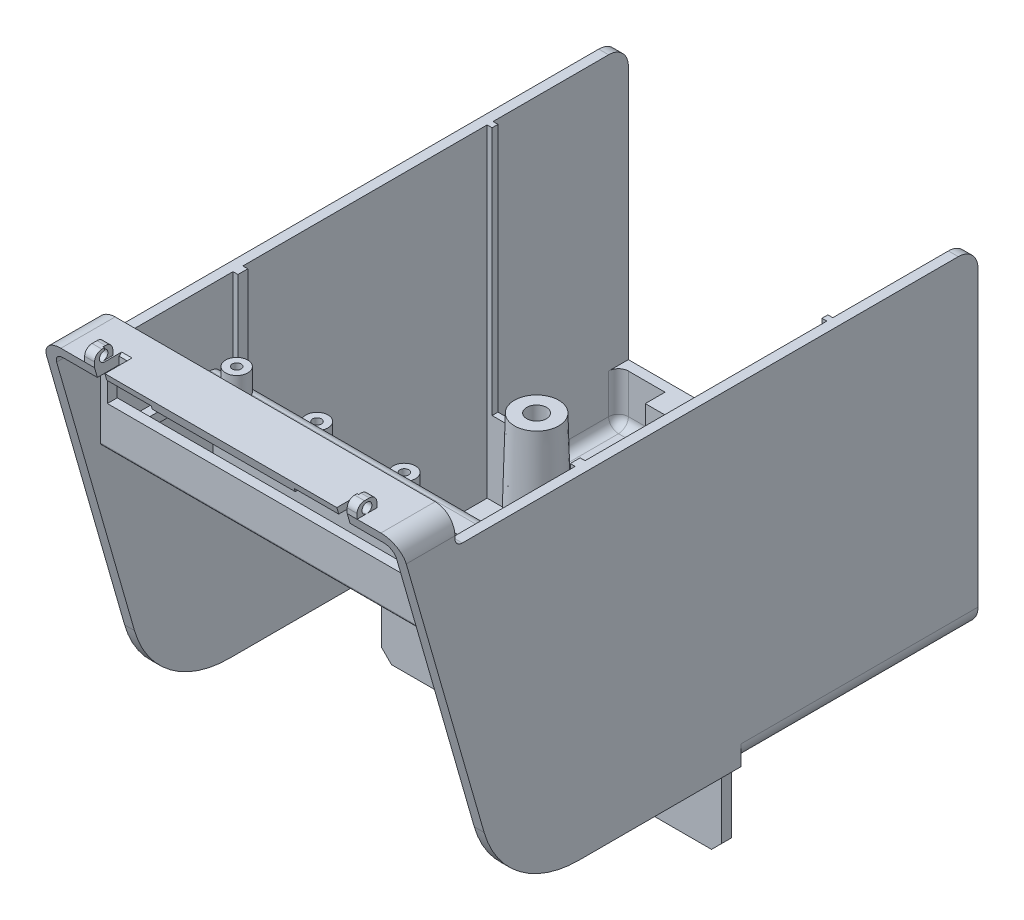
from build123d import *

# Parameters (mm, degrees)
BOSS_EXTRUDE1_DEPTH             = 66
BOSS_EXTRUDE1_DEPTH_BACK        = 7.5
SKETCH1_W                       = 72.85
SKETCH1_H                       = 108.98
CUT_EXTRUDE1_DEPTH              = 113.393427744
CUT_EXTRUDE1_DEPTH_BACK         = 113.393427744
FILLET1_R                       = 0.5
SHELL1_T                        = -2
CUT_EXTRUDE2_REACH              = 84.687
SKETCH3_W                       = 65
SKETCH3_H                       = 10
CUT_EXTRUDE3_REACH              = 79.242
SKETCH4_W                       = 65
SKETCH4_H                       = 10
CUT_EXTRUDE4_REACH              = 89.953
SKETCH5_W                       = 65
SKETCH5_H                       = 10
SKETCH7_R                       = 2.25
BOSS_EXTRUDE2_DEPTH             = 4.5
BOSS_EXTRUDE2_DIRECTION_2_REACH = 85.921
BOSS_EXTRUDE3_DEPTH             = 4.5
BOSS_EXTRUDE3_DEPTH_BACK        = 2
SKETCH8_R                       = 2.25
SKETCH9_R                       = 2.25
BOSS_EXTRUDE4_DEPTH             = 4.5
BOSS_EXTRUDE4_DIRECTION_2_REACH = 88.632
CUT_EXTRUDE5_REACH              = 134.512
SKETCH10_W                      = 66
SKETCH10_H                      = 6.5
SKETCH11_R                      = 5
BOSS_EXTRUDE5_DEPTH             = 19.35
BOSS_EXTRUDE5_DRAFT             = 1.5
BOSS_EXTRUDE5_PROFILE_2_DEPTH   = 19.35
BOSS_EXTRUDE5_PROFILE_2_DRAFT   = 1.5
SKETCH53_R                      = 2
SKETCH53_R_2                    = 2.25
CUT_EXTRUDE30_DEPTH             = 10
BOSS_EXTRUDE6_DEPTH             = 2
SKETCH20_W                      = 68.85
SKETCH20_H                      = 10
BOSS_EXTRUDE7_DEPTH             = 2
CUT_EXTRUDE12_DEPTH             = 118.567353462
CUT_EXTRUDE6_REACH              = 106.346
SKETCH13_W                      = 68.85
SKETCH13_H                      = 2.5
FILLET4_R                       = 3
SKETCH14_W                      = 70.85
SKETCH14_H                      = 118.430630558
CUT_EXTRUDE7_DEPTH              = 1.5
SKETCH17_R                      = 0.9
CUT_EXTRUDE9_DEPTH              = 4
SKETCH18_R                      = 0.9
CUT_EXTRUDE10_DEPTH             = 4
SKETCH19_R                      = 0.9
CUT_EXTRUDE11_DEPTH             = 4
SKETCH22_W                      = 107.98
SKETCH22_H                      = 6
CUT_EXTRUDE13_DEPTH             = 118.567353462
SKETCH23_W                      = 68.85
SKETCH23_H                      = 1
BOSS_EXTRUDE8_DEPTH             = 4
FILLET6_R                       = 2
FILLET7_R                       = 2
FILLET8_R                       = 4
SKETCH28_W                      = 68.85
SKETCH28_H                      = 2
BOSS_EXTRUDE10_DEPTH            = 15.53
CHAMFER2_SIZE                   = 2
SKETCH29_R                      = 1.75
CUT_EXTRUDE16_DEPTH             = 101.855245897
BOSS_EXTRUDE17_REACH            = 118.339
SKETCH56_W                      = 1.2
SKETCH56_H                      = 15
BOSS_EXTRUDE18_REACH            = 118.339
SKETCH57_W                      = 1.2
SKETCH57_H                      = 15
FILLET10_R                      = 2
CUT_EXTRUDE17_DEPTH             = 49.98
SKETCH31_W                      = 2.5
SKETCH31_H                      = 67.5
CUT_EXTRUDE18_DEPTH             = 89.83
BOSS_EXTRUDE11_START            = 0.52
BOSS_EXTRUDE11_DEPTH            = 0.52
SKETCH33_W                      = 68.85
SKETCH33_H                      = 2
BOSS_EXTRUDE12_DEPTH            = 10
FILLET11_R                      = 2
FILLET12_R                      = 4
FILLET13_R                      = 1.5
BOSS_EXTRUDE13_REACH            = 104.947
SKETCH34_W                      = 6
SKETCH34_H                      = 4
SKETCH35_R                      = 1.1
CUT_EXTRUDE19_DEPTH             = 6
FILLET14_R                      = 2
SKETCH37_W                      = 9
SKETCH37_H                      = 2
CUT_EXTRUDE20_DEPTH             = 130.25858047
SKETCH41_W                      = 2
SKETCH41_H                      = 4
BOSS_EXTRUDE15_DEPTH            = 2.5
SKETCH43_R                      = 1
CUT_EXTRUDE22_DEPTH             = 2
FILLET16_R                      = 1.5
FILLET16_OF_MIRROR3_R           = 1.5
SKETCH44_W                      = 2.1
SKETCH44_H                      = 4
CUT_EXTRUDE23_DEPTH             = 2
SKETCH45_W                      = 65
SKETCH45_H                      = 2
CUT_EXTRUDE24_DEPTH             = 1.5
SKETCH46_W                      = 65
SKETCH46_H                      = 2
CUT_EXTRUDE25_DEPTH             = 0.1
SKETCH47_W                      = 65
SKETCH47_H                      = 2
CUT_EXTRUDE26_DEPTH             = 0.1
SKETCH48_W                      = 65
SKETCH48_H                      = 2
BOSS_EXTRUDE16_DEPTH            = 1
SKETCH50_W                      = 2
SKETCH50_H                      = 2.5
CUT_EXTRUDE27_DEPTH             = 0.3
SKETCH51_W                      = 2
SKETCH51_H                      = 2.5
CUT_EXTRUDE28_DEPTH             = 0.3
SKETCH52_W                      = 2.1
SKETCH52_H                      = 2
CUT_EXTRUDE29_DEPTH             = 1
CHAMFER3_SIZE                   = 0.5
SKETCH58_W                      = 1
SKETCH58_H                      = 1.2
BOSS_EXTRUDE19_DEPTH            = 50.5
SKETCH60_W                      = 1
SKETCH60_H                      = 2
BOSS_EXTRUDE21_DEPTH            = 32.87


with BuildPart() as part:
    # Sketch1 → Boss-Extrude1 (new, two sides: drawn at the far end of the back side and taken through both)
    with BuildSketch(Plane(origin=(0, 0, 0), x_dir=(1, 0, 0), z_dir=(0, 1, 0)).offset(-BOSS_EXTRUDE1_DEPTH_BACK)):
        Rectangle(SKETCH1_W, SKETCH1_H)
    extrude(amount=BOSS_EXTRUDE1_DEPTH + BOSS_EXTRUDE1_DEPTH_BACK)

    # Sketch2 → Cut-Extrude1 (cut, two sides: drawn at the far end of the back side and taken through both)
    with BuildSketch(Plane(origin=(36.425, 0, 0), x_dir=(0, 0, -1), z_dir=(1, 0, 0)).offset(-CUT_EXTRUDE1_DEPTH_BACK)):
        Polygon((-54.49, 338.898386454), (-54.49, 66), (-54.49, 42.91), (-31.71, 42.91), (-31.71, 25.13), (-14.01, 25.13), (-14.01, 7.35), (2.51, 7.35), (2.51, -7.5), (2.51, -280.398386454), (-540.989543276, -330.422018615), (-597.989543276, 288.874754292), align=None)
    extrude(amount=CUT_EXTRUDE1_DEPTH + CUT_EXTRUDE1_DEPTH_BACK, mode=Mode.SUBTRACT)

    # Fillet1
    fillet1_edges = [part.edges().sort_by_distance(p)[0] for p in [
        (0, 42.91, 54.49),
        (0, 42.91, 31.71),
        (0, 25.13, 31.71),
        (0, 25.13, 14.01),
        (0, 7.35, 14.01),
        (0, 7.35, -2.51),
    ]]
    fillet(fillet1_edges, radius=FILLET1_R)

    # Shell1
    shell1_openings = [part.faces().sort_by_distance(p)[0] for p in [
        (0, 66, 0),
        (0, 29.25, -54.49),
    ]]
    offset(amount=SHELL1_T, openings=shell1_openings, kind=Kind.INTERSECTION)

    # Sketch3 → Cut-Extrude2 (cut, up to next)
    with BuildSketch(Plane.XZ.offset(-42.91), mode=Mode.PRIVATE) as cut_extrude2_sk1:
        with Locations((0, 42.39)):
            Rectangle(SKETCH3_W, SKETCH3_H)
    cut_extrude2_tool1 = extrude(cut_extrude2_sk1.sketch, amount=-CUT_EXTRUDE2_REACH, mode=Mode.PRIVATE) & part.part
    add(cut_extrude2_tool1.solids().sort_by_distance((0, 42.91, 42.39))[0], mode=Mode.SUBTRACT)

    # Sketch4 → Cut-Extrude3 (cut, up to next)
    with BuildSketch(Plane.XZ.offset(-25.13), mode=Mode.PRIVATE) as cut_extrude3_sk1:
        with Locations((0, 24.61)):
            Rectangle(SKETCH4_W, SKETCH4_H)
    cut_extrude3_tool1 = extrude(cut_extrude3_sk1.sketch, amount=-CUT_EXTRUDE3_REACH, mode=Mode.PRIVATE) & part.part
    add(cut_extrude3_tool1.solids().sort_by_distance((0, 25.13, 24.61))[0], mode=Mode.SUBTRACT)

    # Sketch5 → Cut-Extrude4 (cut, up to next)
    with BuildSketch(Plane.XZ.offset(-7.35), mode=Mode.PRIVATE) as cut_extrude4_sk1:
        with Locations((0, 6.91)):
            Rectangle(SKETCH5_W, SKETCH5_H)
    cut_extrude4_tool1 = extrude(cut_extrude4_sk1.sketch, amount=-CUT_EXTRUDE4_REACH, mode=Mode.PRIVATE) & part.part
    add(cut_extrude4_tool1.solids().sort_by_distance((0, 7.35, 6.91))[0], mode=Mode.SUBTRACT)

    # Sketch7 → Boss-Extrude2 (add)
    with BuildSketch(Plane(origin=(0, 44.91, 0), x_dir=(1, 0, 0), z_dir=(0, 1, 0))):
        with Locations(Location((-28, -33.29, 0), (0, 0, 270))):
            Circle(SKETCH7_R)
        with Locations(Location((28, -33.29, 0), (0, 0, 270))):
            Circle(SKETCH7_R)
    extrude(amount=BOSS_EXTRUDE2_DEPTH)

    # Sketch7 → Boss-Extrude2 direction 2 (add, up to next)
    with BuildSketch(Plane(origin=(0, 44.91, 0), x_dir=(1, 0, 0), z_dir=(0, 1, 0)), mode=Mode.PRIVATE) as boss_extrude2_direction_2_sk1:
        with Locations(Location((-28, -33.29, 0), (0, 0, 270))):
            Circle(SKETCH7_R)
    boss_extrude2_direction_2_tool1 = extrude(boss_extrude2_direction_2_sk1.sketch, amount=-BOSS_EXTRUDE2_DIRECTION_2_REACH, mode=Mode.PRIVATE) - part.part
    # Sketch7 → Boss-Extrude2 direction 2 (add, up to next)
    with BuildSketch(Plane(origin=(0, 44.91, 0), x_dir=(1, 0, 0), z_dir=(0, 1, 0)), mode=Mode.PRIVATE) as boss_extrude2_direction_2_sk2:
        with Locations(Location((28, -33.29, 0), (0, 0, 270))):
            Circle(SKETCH7_R)
    boss_extrude2_direction_2_tool2 = extrude(boss_extrude2_direction_2_sk2.sketch, amount=-BOSS_EXTRUDE2_DIRECTION_2_REACH, mode=Mode.PRIVATE) - part.part
    add(boss_extrude2_direction_2_tool1.solids().sort_by_distance((-28, 44.91, 33.29))[0])
    add(boss_extrude2_direction_2_tool2.solids().sort_by_distance((28, 44.91, 33.29))[0])

    # Sketch8 → Boss-Extrude3 (add, two sides: drawn at the far end of the back side and taken through both)
    with BuildSketch(Plane(origin=(0, 27.13, 0), x_dir=(1, 0, 0), z_dir=(0, 1, 0)).offset(-BOSS_EXTRUDE3_DEPTH_BACK)):
        with Locations(Location((-28, -17.01, 0), (0, 0, 270))):
            Circle(SKETCH8_R)
        with Locations(Location((28, -17.01, 0), (0, 0, 270))):
            Circle(SKETCH8_R)
    extrude(amount=BOSS_EXTRUDE3_DEPTH + BOSS_EXTRUDE3_DEPTH_BACK)

    # Sketch9 → Boss-Extrude4 (add)
    with BuildSketch(Plane(origin=(0, 9.35, 0), x_dir=(1, 0, 0), z_dir=(0, 1, 0))):
        with Locations(Location((-28, 0.69, 0), (0, 0, 270))):
            Circle(SKETCH9_R)
        with Locations(Location((28, 0.69, 0), (0, 0, 270))):
            Circle(SKETCH9_R)
    extrude(amount=BOSS_EXTRUDE4_DEPTH)

    # Sketch9 → Boss-Extrude4 direction 2 (add, up to next)
    with BuildSketch(Plane(origin=(0, 9.35, 0), x_dir=(1, 0, 0), z_dir=(0, 1, 0)), mode=Mode.PRIVATE) as boss_extrude4_direction_2_sk1:
        with Locations(Location((-28, 0.69, 0), (0, 0, 270))):
            Circle(SKETCH9_R)
    boss_extrude4_direction_2_tool1 = extrude(boss_extrude4_direction_2_sk1.sketch, amount=-BOSS_EXTRUDE4_DIRECTION_2_REACH, mode=Mode.PRIVATE) - part.part
    # Sketch9 → Boss-Extrude4 direction 2 (add, up to next)
    with BuildSketch(Plane(origin=(0, 9.35, 0), x_dir=(1, 0, 0), z_dir=(0, 1, 0)), mode=Mode.PRIVATE) as boss_extrude4_direction_2_sk2:
        with Locations(Location((28, 0.69, 0), (0, 0, 270))):
            Circle(SKETCH9_R)
    boss_extrude4_direction_2_tool2 = extrude(boss_extrude4_direction_2_sk2.sketch, amount=-BOSS_EXTRUDE4_DIRECTION_2_REACH, mode=Mode.PRIVATE) - part.part
    add(boss_extrude4_direction_2_tool1.solids().sort_by_distance((-28, 9.35, -0.69))[0])
    add(boss_extrude4_direction_2_tool2.solids().sort_by_distance((28, 9.35, -0.69))[0])

    # Sketch10 → Cut-Extrude5 (cut, up to next)
    with BuildSketch(Plane.XY.offset(54.49), mode=Mode.PRIVATE) as cut_extrude5_sk1:
        with Locations((0, 54.26)):
            Rectangle(SKETCH10_W, SKETCH10_H)
    cut_extrude5_tool1 = extrude(cut_extrude5_sk1.sketch, amount=-CUT_EXTRUDE5_REACH, mode=Mode.PRIVATE) & part.part
    add(cut_extrude5_tool1.solids().sort_by_distance((0, 54.26, 54.49))[0], mode=Mode.SUBTRACT)


with BuildPart() as boss_extrude5_tool:
    # Sketch11 → Boss-Extrude5 (with draft: the straight prism first)
    with BuildSketch(Plane(origin=(0, -5.5, 0), x_dir=(1, 0, 0), z_dir=(0, 1, 0))):
        with Locations((-25, 24.49)):
            Circle(SKETCH11_R)
    extrude(amount=BOSS_EXTRUDE5_DEPTH)
    # Boss-Extrude5: the draft: its side faces are tilted about the plane it starts from
    boss_extrude5_sides = [boss_extrude5_tool.faces().sort_by_distance(p)[0] for p in [
        (-30, 4.175, -24.49),
    ]]
    draft(boss_extrude5_sides, Plane(origin=(0, -5.5, 0), x_dir=(1, 0, 0), z_dir=(0, 1, 0)), BOSS_EXTRUDE5_DRAFT)


with BuildPart() as part_1:
    add(part.part)

    # Boss-Extrude5: add boss_extrude5_tool
    add(boss_extrude5_tool.part)


with BuildPart() as boss_extrude5_profile_2_tool:
    # Sketch11 → Boss-Extrude5 profile 2 (with draft: the straight prism first)
    with BuildSketch(Plane(origin=(0, -5.5, 0), x_dir=(1, 0, 0), z_dir=(0, 1, 0))):
        with Locations((25, 24.49)):
            Circle(SKETCH11_R)
    extrude(amount=BOSS_EXTRUDE5_PROFILE_2_DEPTH)
    # Boss-Extrude5 profile 2: the draft: its side faces are tilted about the plane it starts from
    boss_extrude5_profile_2_sides = [boss_extrude5_profile_2_tool.faces().sort_by_distance(p)[0] for p in [
        (20, 4.175, -24.49),
    ]]
    draft(boss_extrude5_profile_2_sides, Plane(origin=(0, -5.5, 0), x_dir=(1, 0, 0), z_dir=(0, 1, 0)), BOSS_EXTRUDE5_PROFILE_2_DRAFT)


with BuildPart() as part_2:
    add(part_1.part)

    # Boss-Extrude5 profile 2: add boss_extrude5_profile_2_tool
    add(boss_extrude5_profile_2_tool.part)

    # Sketch53 → Cut-Extrude30 (cut)
    with BuildSketch(Plane(origin=(0, 13.85, 0), x_dir=(1, 0, 0), z_dir=(0, 1, 0))):
        with Locations(Location((-25, 24.49, 0), (0, 0, 270))):
            Circle(SKETCH53_R)
        with Locations(Location((25, 24.49, 0), (0, 0, 270))):
            Circle(SKETCH53_R_2)
    extrude(amount=-CUT_EXTRUDE30_DEPTH, mode=Mode.SUBTRACT)

    # Sketch12 → Boss-Extrude6 (add)
    with BuildSketch(Plane.ZY.offset(36.425)):
        with BuildLine():
            Line((54.49, 66), (64.49, 66))
            Line((64.49, 66), (47.568367063, 6.987252884))
            ThreePointArc((47.568367063, 6.987252884), (40.379433608, -3.472710201), (28.343133145, -7.5))
            Line((28.343133145, -7.5), (-54.49, -7.5))
            Line((-54.49, -7.5), (54.49, 66))
        make_face()
    boss_extrude6 = extrude(amount=-BOSS_EXTRUDE6_DEPTH)

    # Mirror1: Boss-Extrude6 across plane
    add(boss_extrude6.mirror(Plane(origin=(0, 0, 0), x_dir=(0, 0, 1), z_dir=(1, 0, 0))))

    # Sketch20 → Boss-Extrude7 (add)
    with BuildSketch(Plane(origin=(0, 66, 0), x_dir=(1, 0, 0), z_dir=(0, 1, 0))):
        with Locations((0, -59.49)):
            Rectangle(SKETCH20_W, SKETCH20_H)
    extrude(amount=-BOSS_EXTRUDE7_DEPTH)

    # Sketch21 → Cut-Extrude12 (cut, through all)
    with BuildSketch(Plane(origin=(36.425, 0, 0), x_dir=(0, 0, -1), z_dir=(1, 0, 0))):
        Polygon((-64.49, 66), (-63.887384385, 63.8984296), (-66.437180196, 63.8984296), align=None)
    extrude(amount=-CUT_EXTRUDE12_DEPTH, mode=Mode.SUBTRACT)

    # Sketch13 → Cut-Extrude6 (cut, up to next)
    with BuildSketch(Plane.XZ.offset(7.5), mode=Mode.PRIVATE) as cut_extrude6_sk1:
        with Locations((0, -53.24)):
            Rectangle(SKETCH13_W, SKETCH13_H)
    cut_extrude6_tool1 = extrude(cut_extrude6_sk1.sketch, amount=-CUT_EXTRUDE6_REACH, mode=Mode.PRIVATE) & part_2.part
    add(cut_extrude6_tool1.solids().sort_by_distance((0, -7.5, -53.24))[0], mode=Mode.SUBTRACT)

    # Fillet4
    fillet4_edges = [part_2.edges().sort_by_distance(p)[0] for p in [
        (35.425, 66, -54.49),
        (-35.425, 66, -54.49),
    ]]
    fillet(fillet4_edges, radius=FILLET4_R)

    # Sketch14 → Cut-Extrude7 (cut)
    with BuildSketch(Plane(origin=(0, 66, 0), x_dir=(1, 0, 0), z_dir=(0, 1, 0))):
        with Locations((0, 5.725315279)):
            Rectangle(SKETCH14_W, SKETCH14_H)
    extrude(amount=-CUT_EXTRUDE7_DEPTH, mode=Mode.SUBTRACT)

    # Sketch17 → Cut-Extrude9 (cut)
    with BuildSketch(Plane(origin=(0, 13.85, 0), x_dir=(1, 0, 0), z_dir=(0, 1, 0))):
        with Locations(Location((-28, 0.69, 0), (0, 0, 270))):
            Circle(SKETCH17_R)
        with Locations(Location((28, 0.69, 0), (0, 0, 270))):
            Circle(SKETCH17_R)
    extrude(amount=-CUT_EXTRUDE9_DEPTH, mode=Mode.SUBTRACT)

    # Sketch18 → Cut-Extrude10 (cut)
    with BuildSketch(Plane(origin=(0, 31.63, 0), x_dir=(1, 0, 0), z_dir=(0, 1, 0))):
        with Locations(Location((-28, -17.01, 0), (0, 0, 270))):
            Circle(SKETCH18_R)
        with Locations(Location((28, -17.01, 0), (0, 0, 270))):
            Circle(SKETCH18_R)
    extrude(amount=-CUT_EXTRUDE10_DEPTH, mode=Mode.SUBTRACT)

    # Sketch19 → Cut-Extrude11 (cut)
    with BuildSketch(Plane(origin=(0, 49.41, 0), x_dir=(1, 0, 0), z_dir=(0, 1, 0))):
        with Locations(Location((-28, -33.29, 0), (0, 0, 270))):
            Circle(SKETCH19_R)
        with Locations(Location((28, -33.29, 0), (0, 0, 270))):
            Circle(SKETCH19_R)
    extrude(amount=-CUT_EXTRUDE11_DEPTH, mode=Mode.SUBTRACT)

    # Sketch22 → Cut-Extrude13 (cut, through all)
    with BuildSketch(Plane(origin=(36.425, 0, 0), x_dir=(0, 0, -1), z_dir=(1, 0, 0))):
        with Locations((0.5, 63)):
            Rectangle(SKETCH22_W, SKETCH22_H)
    extrude(amount=-CUT_EXTRUDE13_DEPTH, mode=Mode.SUBTRACT)

    # Sketch23 → Boss-Extrude8 (add)
    with BuildSketch(Plane(origin=(0, 60, 0), x_dir=(1, 0, 0), z_dir=(0, 1, 0))):
        with Locations((0, -52.99)):
            Rectangle(SKETCH23_W, SKETCH23_H)
    extrude(amount=BOSS_EXTRUDE8_DEPTH)

    # Fillet6
    fillet6_edges = [part_2.edges().sort_by_distance(p)[0] for p in [
        (34.425, 64, 52.99),
        (-34.425, 64, 52.99),
    ]]
    fillet(fillet6_edges, radius=FILLET6_R)

    # Fillet7
    fillet7_edges = [part_2.edges().sort_by_distance(p)[0] for p in [
        (34.425, 64, 59.203254614),
        (-34.425, 64, 59.203254614),
    ]]
    fillet(fillet7_edges, radius=FILLET7_R)

    # Fillet8
    fillet8_edges = [part_2.edges().sort_by_distance(p)[0] for p in [
        (36.425, 66, 58.99),
        (-36.425, 66, 58.99),
    ]]
    fillet(fillet8_edges, radius=FILLET8_R)

    # Sketch28 → Boss-Extrude10 (add)
    with BuildSketch(Plane.XZ.offset(7.5)):
        with Locations((0, -3.51)):
            Rectangle(SKETCH28_W, SKETCH28_H)
    extrude(amount=BOSS_EXTRUDE10_DEPTH)

    # Chamfer2
    chamfer2_edges = [part_2.edges().sort_by_distance(p)[0] for p in [
        (-34.425, -23.03, -3.51),
        (34.425, -23.03, -3.51),
    ]]
    chamfer(chamfer2_edges, length=CHAMFER2_SIZE)

    # Sketch29 → Cut-Extrude16 (cut, through all)
    with BuildSketch(Plane.XY.offset(-2.51)):
        with Locations((-24.425, -15.03)):
            Circle(SKETCH29_R)
        with Locations((24.425, -15.03)):
            Circle(SKETCH29_R)
    extrude(amount=-CUT_EXTRUDE16_DEPTH, mode=Mode.SUBTRACT)

    # Boss-Extrude17: up to this cone (the profile starts outside it)
    boss_extrude17_end = Plane(origin=(-25, 2, -24.49), z_dir=(0, -1, 0)) * Cone(1.565910016, 8.041301161, 247.285211176, mode=Mode.PRIVATE)
    # Sketch56 → Boss-Extrude17 (add, up to the surface)
    with BuildSketch(Plane(origin=(-34.425, 0, 0), x_dir=(0, 0, -1), z_dir=(1, 0, 0)), mode=Mode.PRIVATE) as boss_extrude17_sk1:
        with Locations((24.49, 2)):
            Rectangle(SKETCH56_W, SKETCH56_H)
    boss_extrude17_tool1 = extrude(boss_extrude17_sk1.sketch, amount=BOSS_EXTRUDE17_REACH, mode=Mode.PRIVATE) - boss_extrude17_end
    add(boss_extrude17_tool1.solids().sort_by_distance((-34.425, 2, -24.49))[0])

    # Boss-Extrude18: up to this cone (the profile starts outside it)
    boss_extrude18_end = Plane(origin=(25, 2, -24.49), z_dir=(0, -1, 0)) * Cone(1.565910016, 8.041301161, 247.285211176, mode=Mode.PRIVATE)
    # Sketch57 → Boss-Extrude18 (add, up to the surface)
    with BuildSketch(Plane.ZY.offset(-34.425), mode=Mode.PRIVATE) as boss_extrude18_sk1:
        with Locations((-24.49, 2)):
            Rectangle(SKETCH57_W, SKETCH57_H)
    boss_extrude18_tool1 = extrude(boss_extrude18_sk1.sketch, amount=BOSS_EXTRUDE18_REACH, mode=Mode.PRIVATE) - boss_extrude18_end
    add(boss_extrude18_tool1.solids().sort_by_distance((34.425, 2, -24.49))[0])

    # Fillet10
    fillet10_edges = [part_2.edges().sort_by_distance(p)[0] for p in [
        (-34.425, -5.5, -38.54),
        (34.425, -5.5, -14.2),
    ]]
    fillet(fillet10_edges, radius=FILLET10_R)

    # Sketch30 → Cut-Extrude17 (cut)
    with BuildSketch(Plane(origin=(0, 0, -54.49), x_dir=(-1, 0, 0), z_dir=(0, 0, -1))):
        with BuildLine():
            Line((-36.425, -3.5), (-36.425, -7.5))
            Line((-36.425, -7.5), (-32.425, -7.5))
            ThreePointArc((-32.425, -7.5), (-35.253427125, -6.328427125), (-36.425, -3.5))
        make_face()
        with BuildLine():
            Line((36.425, -7.5), (32.425, -7.5))
            ThreePointArc((32.425, -7.5), (35.253427125, -6.328427125), (36.425, -3.5))
            Line((36.425, -3.5), (36.425, -7.5))
        make_face()
    extrude(amount=-CUT_EXTRUDE17_DEPTH, mode=Mode.SUBTRACT)

    # Sketch31 → Cut-Extrude18 (cut, symmetric)
    with BuildSketch(Plane.ZY):
        with Locations((-53.24, 26.25)):
            Rectangle(SKETCH31_W, SKETCH31_H)
    extrude(amount=CUT_EXTRUDE18_DEPTH, both=True, mode=Mode.SUBTRACT)

    # Sketch32 → Boss-Extrude11 (add)
    with BuildSketch(Plane(origin=(0, 0, -51.99), x_dir=(-1, 0, 0), z_dir=(0, 0, -1)).offset(BOSS_EXTRUDE11_START)):
        with BuildLine():
            Line((-34.425, -5.5), (-34.425, 60))
            Line((-34.425, 60), (-36.425, 60))
            Line((-36.425, 60), (-36.425, -3.5))
            ThreePointArc((-36.425, -3.5), (-35.253427125, -6.328427125), (-32.425, -7.5))
            Line((-32.425, -7.5), (32.425, -7.5))
            ThreePointArc((32.425, -7.5), (35.253427125, -6.328427125), (36.425, -3.5))
            Line((36.425, -3.5), (36.425, 60))
            Line((36.425, 60), (34.425, 60))
            Line((34.425, 60), (34.425, -3.5))
            ThreePointArc((34.425, -3.5), (33.839213562, -4.914213562), (32.425, -5.5))
            Line((32.425, -5.5), (-34.425, -5.5))
        make_face()
    extrude(amount=-BOSS_EXTRUDE11_DEPTH)

    # Sketch33 → Boss-Extrude12 (add)
    with BuildSketch(Plane(origin=(0, -5.5, 0), x_dir=(1, 0, 0), z_dir=(0, 1, 0))):
        with Locations((0, 51.51)):
            Rectangle(SKETCH33_W, SKETCH33_H)
    extrude(amount=BOSS_EXTRUDE12_DEPTH)

    # Fillet11
    fillet11_edges = [part_2.edges().sort_by_distance(p)[0] for p in [
        (-33.839213562, -4.914213562, -50.51),
        (-34.425, 0.5, -50.51),
        (1, -5.5, -50.51),
    ]]
    fillet(fillet11_edges, radius=FILLET11_R)

    # Fillet12
    fillet12_edges = [part_2.edges().sort_by_distance(p)[0] for p in [
        (35.425, 60, -52.51),
        (-35.425, 60, -52.51),
    ]]
    fillet(fillet12_edges, radius=FILLET12_R)

    # Fillet13
    # the kernel refuses this fillet: 1.5 mm, written as the material it adds along each edge
    with BuildSketch(Plane(origin=(-34.425, 60, 53.49), x_dir=(0, 0, -1), z_dir=(-1, 0, 0))) as fillet13_piece_1:
        with BuildLine():
            CenterArc((FILLET13_R, -FILLET13_R), FILLET13_R, 90, 90)
            Line((0, -FILLET13_R), (0, 0))
            Line((0, 0), (FILLET13_R, 0))
        make_face()
    extrude(amount=2)
    with BuildSketch(Plane(origin=(36.425, 60, 53.49), x_dir=(0, 1, 0), z_dir=(-1, 0, 0))) as fillet13_piece_2:
        with BuildLine():
            CenterArc((FILLET13_R, FILLET13_R), FILLET13_R, 180, 90)
            Line((0, FILLET13_R), (0, 0))
            Line((0, 0), (FILLET13_R, 0))
        make_face()
    extrude(amount=2)

    # Boss-Extrude13: up to this face of the body (flat: up to its plane)
    boss_extrude13_end = Plane(part_2.part.faces().sort_by_distance((-0.210504668, 4.5, -51.501037074))[0])
    # Sketch34 → Boss-Extrude13 (add, up to the picked face)
    with BuildSketch(Plane(origin=(0, -5.5, 0), x_dir=(1, 0, 0), z_dir=(0, 1, 0)), mode=Mode.PRIVATE) as boss_extrude13_sk1:
        with Locations((-22, 48.51)):
            Rectangle(SKETCH34_W, SKETCH34_H)
    boss_extrude13_tool1 = split(extrude(boss_extrude13_sk1.sketch, amount=BOSS_EXTRUDE13_REACH, mode=Mode.PRIVATE), bisect_by=boss_extrude13_end, keep=Keep.BOTH, mode=Mode.PRIVATE)
    boss_extrude13 = boss_extrude13_tool1.solids().sort_by(Axis((-22, -5.5, -48.51), (0, 1, 0)))[0]
    add(boss_extrude13)

    # Sketch35 → Cut-Extrude19 (cut)
    with BuildSketch(Plane(origin=(0, 0, -52.51), x_dir=(-1, 0, 0), z_dir=(0, 0, -1))):
        with Locations((22, 0.5)):
            Circle(SKETCH35_R)
    cut_extrude19 = extrude(amount=-CUT_EXTRUDE19_DEPTH, mode=Mode.SUBTRACT)

    # Mirror2: Boss-Extrude13, Cut-Extrude19 across plane
    add(boss_extrude13.mirror(Plane(origin=(0, 0, 0), x_dir=(0, 0, 1), z_dir=(1, 0, 0))))
    add(cut_extrude19.mirror(Plane(origin=(0, 0, 0), x_dir=(0, 0, 1), z_dir=(1, 0, 0))), mode=Mode.SUBTRACT)

    # Fillet14
    # the kernel refuses this fillet: 2 mm, written as the material it adds along each edge
    with BuildSketch(Plane(origin=(37.425, 64, 54.49), x_dir=(0, 0, 1), z_dir=(-1, 0, 0))) as fillet14_piece_1_section:
        with BuildLine():
            CenterArc((FILLET14_R, -FILLET14_R), FILLET14_R, 90, 90)
            Line((0, -FILLET14_R), (0, 0))
            Line((0, 0), (FILLET14_R, 0))
        make_face()
    fillet14_piece_1 = extrude(amount=74.85, mode=Mode.PRIVATE)
    fillet14_piece_1 = split(fillet14_piece_1, bisect_by=Plane(origin=(34.425, 63.403727496, 54.836272503), z_dir=(-1, 0, 0)), keep=Keep.TOP, mode=Mode.PRIVATE)
    fillet14_piece_1 = split(fillet14_piece_1, bisect_by=Plane(origin=(-34.425, 63.403727496, 54.836272503), z_dir=(1, 0, 0)), keep=Keep.TOP, mode=Mode.PRIVATE)
    add(fillet14_piece_1)

    # Sketch37 → Cut-Extrude20 (cut, through all)
    with BuildSketch(Plane.XY.offset(52.49)):
        with Locations((-19, 63.66)):
            Rectangle(SKETCH37_W, SKETCH37_H)
        with Locations((19, 63.66)):
            Rectangle(SKETCH37_W, SKETCH37_H)
    extrude(amount=CUT_EXTRUDE20_DEPTH, mode=Mode.SUBTRACT)

    # Sketch41 → Boss-Extrude15 (add)
    with BuildSketch(Plane(origin=(0, 66, 0), x_dir=(1, 0, 0), z_dir=(0, 1, 0))):
        with Locations((-26.6, -62.49)):
            Rectangle(SKETCH41_W, SKETCH41_H)
    boss_extrude15 = extrude(amount=BOSS_EXTRUDE15_DEPTH)

    # Sketch43 → Cut-Extrude22 (cut)
    with BuildSketch(Plane(origin=(-25.6, 0, 0), x_dir=(0, 0, -1), z_dir=(1, 0, 0))):
        with Locations(Location((-62.49, 67, 0), (0, 0, 270))):
            Circle(SKETCH43_R)
    cut_extrude22 = extrude(amount=-CUT_EXTRUDE22_DEPTH, mode=Mode.SUBTRACT)

    # Fillet16
    fillet16_edges = [part_2.edges().sort_by_distance(p)[0] for p in [
        (-26.6, 68.5, 60.49),
        (-26.6, 68.5, 64.49),
    ]]
    fillet(fillet16_edges, radius=FILLET16_R)

    # Mirror3: Boss-Extrude15, Cut-Extrude22 across plane
    add(boss_extrude15.mirror(Plane(origin=(0, 0, 0), x_dir=(0, 0, 1), z_dir=(1, 0, 0))))
    add(cut_extrude22.mirror(Plane(origin=(0, 0, 0), x_dir=(0, 0, 1), z_dir=(1, 0, 0))), mode=Mode.SUBTRACT)

    # Fillet16 of Mirror3
    fillet16_of_mirror3_edges = [part_2.edges().sort_by_distance(p)[0] for p in [
        (26.6, 68.5, 60.49),
        (26.6, 68.5, 64.49),
    ]]
    fillet(fillet16_of_mirror3_edges, radius=FILLET16_OF_MIRROR3_R)

    # Sketch44 → Cut-Extrude23 (cut)
    with BuildSketch(Plane(origin=(0, 66, 0), x_dir=(1, 0, 0), z_dir=(0, 1, 0))):
        with Locations((-24.55, -62.49)):
            Rectangle(SKETCH44_W, SKETCH44_H)
        with Locations((24.55, -62.49)):
            Rectangle(SKETCH44_W, SKETCH44_H)
    extrude(amount=-CUT_EXTRUDE23_DEPTH, mode=Mode.SUBTRACT)

    # Sketch45 → Cut-Extrude24 (cut)
    with BuildSketch(Plane.XY.offset(37.39)):
        with Locations((0, 43.91)):
            Rectangle(SKETCH45_W, SKETCH45_H)
    extrude(amount=-CUT_EXTRUDE24_DEPTH, mode=Mode.SUBTRACT)

    # Sketch46 → Cut-Extrude25 (cut)
    with BuildSketch(Plane(origin=(0, 0, 29.61), x_dir=(-1, 0, 0), z_dir=(0, 0, -1))):
        with Locations((0, 26.13)):
            Rectangle(SKETCH46_W, SKETCH46_H)
    extrude(amount=-CUT_EXTRUDE25_DEPTH, mode=Mode.SUBTRACT)

    # Sketch47 → Cut-Extrude26 (cut)
    with BuildSketch(Plane(origin=(0, 0, 11.91), x_dir=(-1, 0, 0), z_dir=(0, 0, -1))):
        with Locations((0, 8.35)):
            Rectangle(SKETCH47_W, SKETCH47_H)
    extrude(amount=-CUT_EXTRUDE26_DEPTH, mode=Mode.SUBTRACT)

    # Sketch48 → Boss-Extrude16 (add)
    with BuildSketch(Plane(origin=(0, 0, 47.39), x_dir=(-1, 0, 0), z_dir=(0, 0, -1))):
        with Locations((0, 43.91)):
            Rectangle(SKETCH48_W, SKETCH48_H)
    extrude(amount=BOSS_EXTRUDE16_DEPTH)

    # Sketch50 → Cut-Extrude27 (cut)
    with BuildSketch(Plane(origin=(-25.6, 0, 0), x_dir=(0, 0, -1), z_dir=(1, 0, 0))):
        with Locations((-61.49, 67.25)):
            Rectangle(SKETCH50_W, SKETCH50_H)
    extrude(amount=-CUT_EXTRUDE27_DEPTH, mode=Mode.SUBTRACT)

    # Sketch51 → Cut-Extrude28 (cut)
    with BuildSketch(Plane.ZY.offset(-25.6)):
        with Locations((61.49, 67.25)):
            Rectangle(SKETCH51_W, SKETCH51_H)
    extrude(amount=-CUT_EXTRUDE28_DEPTH, mode=Mode.SUBTRACT)

    # Sketch52 → Cut-Extrude29 (cut)
    with BuildSketch(Plane.XY.offset(60.49)):
        with Locations((-24.55, 65)):
            Rectangle(SKETCH52_W, SKETCH52_H)
        with Locations((24.55, 65)):
            Rectangle(SKETCH52_W, SKETCH52_H)
    extrude(amount=-CUT_EXTRUDE29_DEPTH, mode=Mode.SUBTRACT)

    # Chamfer3
    chamfer3_edges = [part_2.edges().sort_by_distance(p)[0] for p in [
        (-24.55, 66, 59.49),
        (24.55, 66, 59.49),
    ]]
    chamfer(chamfer3_edges, length=CHAMFER3_SIZE)

    # Sketch58 → Boss-Extrude19 (add)
    with BuildSketch(Plane(origin=(0, 9.5, 0), x_dir=(1, 0, 0), z_dir=(0, 1, 0))):
        with Locations((-33.925, 24.49)):
            Rectangle(SKETCH58_W, SKETCH58_H)
        with Locations((33.925, 24.49)):
            Rectangle(SKETCH58_W, SKETCH58_H)
    extrude(amount=BOSS_EXTRUDE19_DEPTH)

    # Sketch60 → Boss-Extrude21 (add)
    with BuildSketch(Plane(origin=(0, 27.13, 0), x_dir=(1, 0, 0), z_dir=(0, 1, 0))):
        with Locations((-33.925, -26.61)):
            Rectangle(SKETCH60_W, SKETCH60_H)
        with Locations((33.925, -26.11)):
            Rectangle(SKETCH60_W, SKETCH60_H)
    extrude(amount=BOSS_EXTRUDE21_DEPTH)


solid = part_2.part
